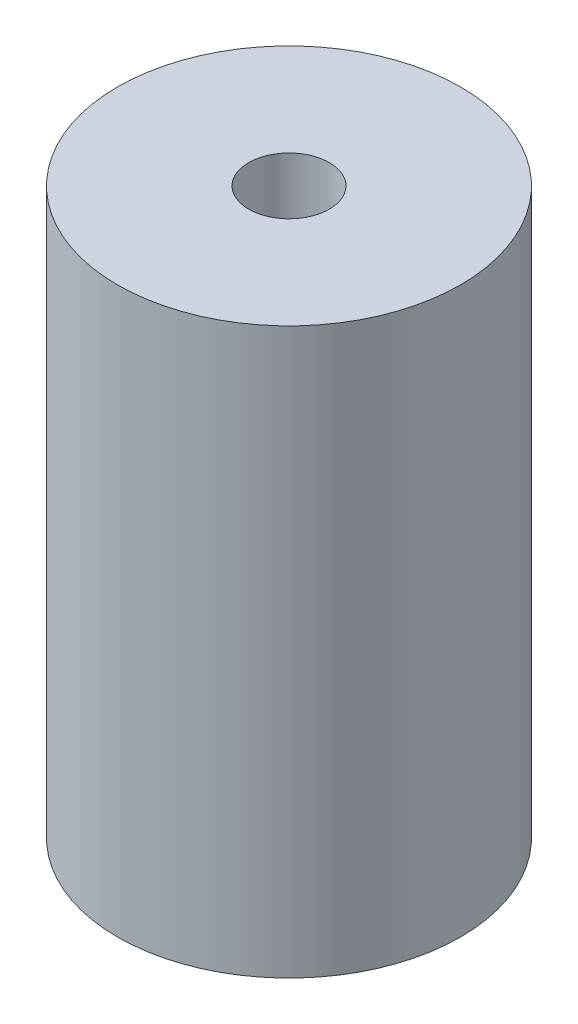
from build123d import *

# Parameters (mm, degrees)
SKETCH1_R           = 26.9875
SKETCH1_R_2         = 6.35
BOSS_EXTRUDE1_DEPTH = 88.9


with BuildPart() as part:
    # Sketch1 → Boss-Extrude1 (new body)
    with BuildSketch(Plane(origin=(0, 0, 0), x_dir=(1, 0, 0), z_dir=(0, 1, 0))):
        Circle(SKETCH1_R)
        Circle(SKETCH1_R_2, mode=Mode.SUBTRACT)
    extrude(amount=BOSS_EXTRUDE1_DEPTH)


solid = part.part
